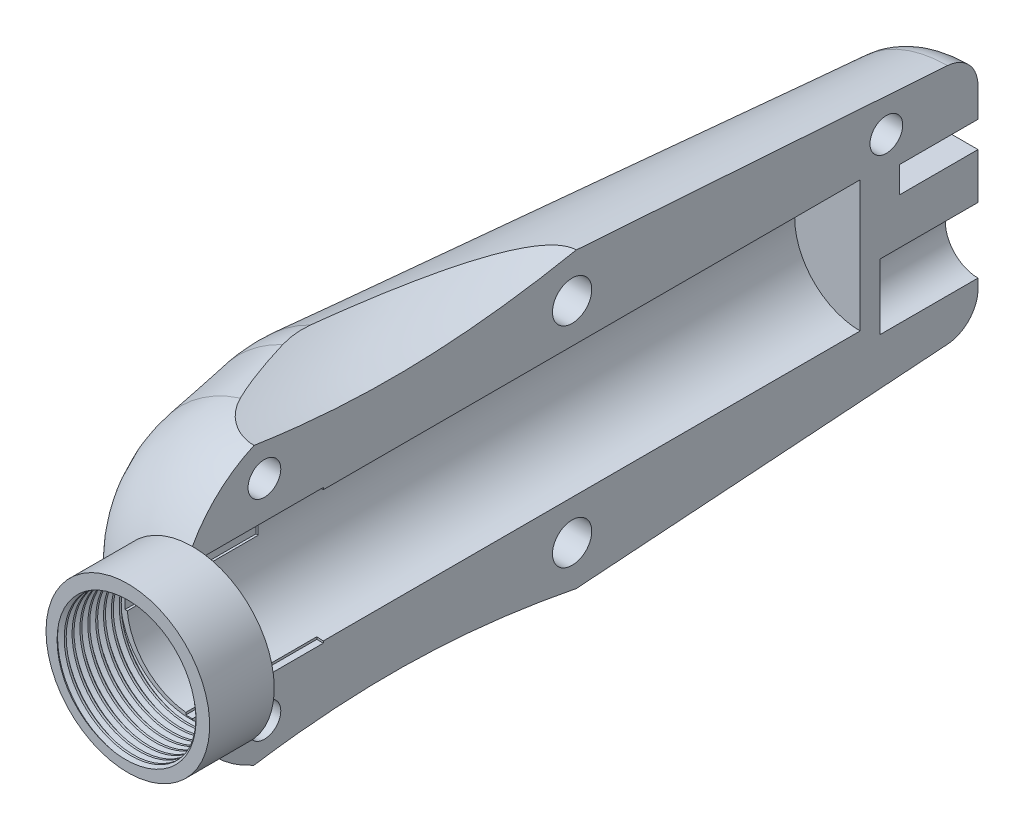
from build123d import *

# Parameters (mm, degrees)
SKETCH1_R           = 11.25
SKETCH1_R_2         = 5
BOSS_EXTRUDE1_DEPTH = 51
BOSS_EXTRUDE2_START = 9
SKETCH2_R           = 11.25
BOSS_EXTRUDE2_DEPTH = 9
CUT_EXTRUDE1_DEPTH  = 6
CUT_EXTRUDE2_START  = -2.5
SKETCH4_W           = 10
SKETCH4_H           = 2.5
CUT_EXTRUDE2_DEPTH  = 5
SKETCH5_R           = 2.5
CUT_EXTRUDE3_DEPTH  = 7.5
SKETCH6_W           = 1
SKETCH6_H           = 0.25
SKETCH6_W_2         = 0.25
SKETCH6_H_2         = 1
CUT_EXTRUDE4_DEPTH  = 10
SKETCH7_W           = 22.5
SKETCH7_H           = 22.5
SKETCH7_R           = 7.5
BOSS_EXTRUDE3_DEPTH = 55
SKETCH11_R          = 6.25
SKETCH11_R_2        = 5.5
BOSS_EXTRUDE4_DEPTH = 5
THREAD1_PITCH       = 0.6
SKETCH14_W          = 14.477531198
SKETCH14_H          = 32.54061919
CUT_EXTRUDE5_DEPTH  = 30
CIRPATTERN1_COUNT   = 4
FILLET1_R           = 10
FILLET2_R           = 10
FILLET5_R           = 2.5
SKETCH19_W          = 15.616957128
SKETCH19_H          = 30.431834888
CUT_EXTRUDE6_DEPTH  = 60
SKETCH20_R          = 1.25
SKETCH20_R_2        = 1.5
CUT_EXTRUDE7_DEPTH  = 3


with BuildPart() as part:
    # Sketch1 → Boss-Extrude1 (new body)
    with BuildSketch(Plane.XY):
        Circle(SKETCH1_R)
        Circle(SKETCH1_R_2, mode=Mode.SUBTRACT)
    extrude(amount=BOSS_EXTRUDE1_DEPTH)

    # Sketch2 → Boss-Extrude2 (add)
    with BuildSketch(Plane(origin=(0, 0, 0), x_dir=(-1, 0, 0), z_dir=(0, 0, -1)).offset(BOSS_EXTRUDE2_START)):
        Circle(SKETCH2_R)
    extrude(amount=-BOSS_EXTRUDE2_DEPTH)

    # Sketch3 → Cut-Extrude1 (cut)
    with BuildSketch(Plane(origin=(0, 0, -9), x_dir=(-1, 0, 0), z_dir=(0, 0, -1))):
        Polygon((-2, 4.5), (-3, 3.5), (-3, 2.5), (3, 2.5), (3, 3.5), (2, 4.5), align=None)
    extrude(amount=-CUT_EXTRUDE1_DEPTH, mode=Mode.SUBTRACT)

    # Sketch4 → Cut-Extrude2 (cut)
    with BuildSketch(Plane(origin=(0, 0, -9), x_dir=(-1, 0, 0), z_dir=(0, 0, -1)).offset(CUT_EXTRUDE2_START)):
        with Locations((0, -2.25)):
            Rectangle(SKETCH4_W, SKETCH4_H)
    extrude(amount=-CUT_EXTRUDE2_DEPTH, mode=Mode.SUBTRACT)

    # Sketch5 → Cut-Extrude3 (cut)
    with BuildSketch(Plane(origin=(0, 0, -9), x_dir=(-1, 0, 0), z_dir=(0, 0, -1))):
        with Locations((0, -3.5)):
            Circle(SKETCH5_R)
    extrude(amount=-CUT_EXTRUDE3_DEPTH, mode=Mode.SUBTRACT)

    # Sketch6 → Cut-Extrude4 (cut)
    with BuildSketch(Plane.XY.offset(51)):
        with Locations((0, 5.025)):
            Rectangle(SKETCH6_W, SKETCH6_H)
        with Locations((-5.025, 0)):
            Rectangle(SKETCH6_W_2, SKETCH6_H_2)
        with Locations((5.025, 0)):
            Rectangle(SKETCH6_W_2, SKETCH6_H_2)
        with Locations((0, -5.025)):
            Rectangle(SKETCH6_W, SKETCH6_H)
    extrude(amount=-CUT_EXTRUDE4_DEPTH, mode=Mode.SUBTRACT)

    # Sketch7 → Boss-Extrude3 (add)
    with BuildSketch(Plane.XY.offset(51)):
        Rectangle(SKETCH7_W, SKETCH7_H)
        Circle(SKETCH7_R, mode=Mode.SUBTRACT)
    extrude(amount=-BOSS_EXTRUDE3_DEPTH)

    # Sketch11 → Boss-Extrude4 (add)
    with BuildSketch(Plane.XY.offset(51)):
        Circle(SKETCH11_R)
        Circle(SKETCH11_R_2, mode=Mode.SUBTRACT)
    extrude(amount=BOSS_EXTRUDE4_DEPTH)

    # Thread1: the profile of Thread Profile1 profile screwed along a right-hand helix of 10 turns, 6 arcs to a turn; built about Z, then put on its axis
    thread1_z = Axis((0, 0, 0), (0, 0, 1))
    thread1_corners = [(5.5003, 0, -0.000173205), (5.5003, 0, 0.525173203), (5.175240475, 0, 0.337499999), (5.175240475, 0, 0.187499999)]
    with BuildLine(mode=Mode.PRIVATE) as thread1_profile:
        Line(thread1_corners[0], thread1_corners[1])
        Line(thread1_corners[1], thread1_corners[2])
        Line(thread1_corners[2], thread1_corners[3])
        Line(thread1_corners[3], thread1_corners[0])
    thread1_cap = Face(thread1_profile.wire())
    thread1_turn_angles = [0, 30, 60, 90, 120, 150, 180, 210, 240, 270, 300, 330, 360]
    thread1_turn_weights = [1, 0.8660254037844387, 1, 0.8660254037844387, 1, 0.8660254037844387, 1, 0.8660254037844387, 1, 0.8660254037844387, 1, 0.8660254037844387, 1]
    thread1_turn_rails = [Edge.make_bspline([Vector(p[0], p[1], 0).rotate(thread1_z, thread1_turn_angles[k]) / thread1_turn_weights[k] + Vector(0, 0, p[2] + THREAD1_PITCH * thread1_turn_angles[k] / 360) for k in range(13)], [0, 0, 0, 1, 1, 2, 2, 3, 3, 4, 4, 5, 5, 6, 6, 6], 2, thread1_turn_weights) for p in thread1_corners]
    thread1_turn_sides = [Face.make_surface_from_curves(thread1_turn_rails[p[0]], thread1_turn_rails[p[1]]) for p in [(0, 1), (1, 2), (2, 3), (3, 0)]]
    thread1 = Plane(origin=(0, 0, 57), x_dir=(-1, 0, 0), z_dir=(0, 0, -1)) * Solid(Shell([*[p.moved(Location((0, 0, THREAD1_PITCH * i))) for i in range(10) for p in thread1_turn_sides], thread1_cap, thread1_cap.rotate(thread1_z, 3600).moved(Location((0, 0, THREAD1_PITCH * 3600 / 360)))]))
    add(thread1)

    # Sketch14 → Cut-Extrude5 (cut)
    with BuildSketch(Plane(origin=(11.25, 0, 0), x_dir=(0, 0, -1), z_dir=(1, 0, 0))):
        with Locations((-63.170516655, 2.469298546)):
            Rectangle(SKETCH14_W, SKETCH14_H)
    extrude(amount=-CUT_EXTRUDE5_DEPTH, mode=Mode.SUBTRACT)

    # Sketch15 → Cut-Revolve2 (revolve, cut)
    with BuildSketch(Plane(origin=(0, 0, 0), x_dir=(1, 0, 0), z_dir=(0, 1, 0)), mode=Mode.PRIVATE) as cut_revolve2_sk:
        Polygon((-9, 9.75), (-12.321523567, -37.75), (-9, -57.75), (-13.720059806, -57.75), (-54, -633.779981552), (-54, 9.75), align=None)
    revolve(cut_revolve2_sk.sketch.rotate(Axis((0, 0, 0), (0, 0, -1)), 354.260829523), axis=Axis((0, 0, 0), (0, 0, -1)), mode=Mode.SUBTRACT)

    # Sketch17 → Cut-Revolve3 (revolve, cut)
    with BuildSketch(Plane(origin=(0, 22.25, 0), x_dir=(1, 0, 0), z_dir=(0, 1, 0))):
        with BuildLine():
            Line((0, 8.75), (0, -80.25))
            add(Edge.make_bspline(
                [(0, 8.75), (-6.837392998, -4.833326361), (-18.162607002, -35.75), (-6.837392998, -66.666673639), (0, -80.25)],
                knots=[0, 0, 0, 0, 0.5, 1, 1, 1, 1], degree=3))
        make_face()
    cut_revolve3 = revolve(axis=Axis((0, 22.25, -8.75), (0, 0, 1)), mode=Mode.SUBTRACT)

    # CirPattern1: Cut-Revolve3 ×4 about axis
    cirpattern1_axis = Axis((0, 0, 56), (0, 0, -1))
    for i in range(1, CIRPATTERN1_COUNT):
        add(cut_revolve3.rotate(cirpattern1_axis, i * 360 / CIRPATTERN1_COUNT), mode=Mode.SUBTRACT)

    # Fillet1
    # the kernel refuses this fillet: 10 mm, written as the material it takes off along each edge
    with BuildSketch(Plane(origin=(0, 0, 51), x_dir=(-0.9949874371070855, -0.0999999999953677, 0), z_dir=(-0.0999999999953677, 0.9949874371070855, 0))) as fillet1_piece_1:
        with BuildLine():
            CenterArc((1.440076791, -8.76724807), FILLET1_R, 9.429400963, 51.820366909)
            Line((11.304959012, -7.128926131), (11.502256656, -7.096159692))
            Line((11.502256656, -7.096159692), (10.318311848, 0.032766439))
            Line((10.318311848, 0.032766439), (10.121014204, 0.2))
            ThreePointArc((10.121014204, 0.2), (8.185507102, 0.2), (6.346198464, 0.175344961))
            Line((6.346198464, 0.175344961), (6.25, 0))
        make_face()
    revolve(axis=Axis((0, 0, 51), (0, 0, 1)), mode=Mode.SUBTRACT)

    # Fillet2
    # the kernel refuses this fillet: 10 mm, written as the material it takes off along each edge
    with BuildSketch(Plane(origin=(0, 0, 37.75), x_dir=(-0.9757453399449544, 0.21890872887051724, 0), z_dir=(-0.21890872887051724, -0.9757453399449544, 0))) as fillet2_piece_1:
        with BuildLine():
            CenterArc((12.321523567 - FILLET2_R * 1.00577669767, FILLET2_R * 0.0476898560037), FILLET2_R, 350.570599037, 13.429400963)
            Line((12.321523567 - FILLET2_R * 0.00821264741373, FILLET2_R * 0.117446329748), (12.321523567, 0))
            Line((12.321523567, 0), (12.321523567 - FILLET2_R * 0.0192884756277, -FILLET2_R * 0.116142337917))
        make_face()
    revolve(axis=Axis((0, 0, 37.75), (0, 0, -1)), revolution_arc=64.710109031, mode=Mode.SUBTRACT)
    with BuildSketch(Plane(origin=(0, 0, 37.75), x_dir=(-0.21890872887051768, -0.975745339944954, 0), z_dir=(0.975745339944954, -0.21890872887051768, 0))) as fillet2_piece_2:
        with BuildLine():
            CenterArc((12.321523567 - FILLET2_R * 1.00577669767, FILLET2_R * 0.0476898560037), FILLET2_R, 350.570599037, 13.429400963)
            Line((12.321523567 - FILLET2_R * 0.00821264741373, FILLET2_R * 0.117446329748), (12.321523567, 0))
            Line((12.321523567, 0), (12.321523567 - FILLET2_R * 0.0192884756277, -FILLET2_R * 0.116142337917))
        make_face()
    revolve(axis=Axis((0, 0, 37.75), (0, 0, -1)), revolution_arc=64.710109031, mode=Mode.SUBTRACT)
    with BuildSketch(Plane(origin=(0, 0, 37.75), x_dir=(0.9757453399449539, -0.21890872887051863, 0), z_dir=(0.21890872887051863, 0.9757453399449539, 0))) as fillet2_piece_3:
        with BuildLine():
            CenterArc((12.321523567 - FILLET2_R * 1.00577669767, FILLET2_R * 0.0476898560037), FILLET2_R, 350.570599037, 13.429400963)
            Line((12.321523567 - FILLET2_R * 0.00821264741373, FILLET2_R * 0.117446329748), (12.321523567, 0))
            Line((12.321523567, 0), (12.321523567 - FILLET2_R * 0.0192884756277, -FILLET2_R * 0.116142337917))
        make_face()
    revolve(axis=Axis((0, 0, 37.75), (0, 0, -1)), revolution_arc=64.710109031, mode=Mode.SUBTRACT)
    with BuildSketch(Plane(origin=(0, 0, 37.75), x_dir=(0.21890872887051785, 0.9757453399449543, 0), z_dir=(-0.9757453399449543, 0.21890872887051785, 0))) as fillet2_piece_4:
        with BuildLine():
            CenterArc((12.321523567 - FILLET2_R * 1.00577669767, FILLET2_R * 0.0476898560037), FILLET2_R, 350.570599037, 13.429400963)
            Line((12.321523567 - FILLET2_R * 0.00821264741373, FILLET2_R * 0.117446329748), (12.321523567, 0))
            Line((12.321523567, 0), (12.321523567 - FILLET2_R * 0.0192884756277, -FILLET2_R * 0.116142337917))
        make_face()
    revolve(axis=Axis((0, 0, 37.75), (0, 0, -1)), revolution_arc=64.710109031, mode=Mode.SUBTRACT)

    # Fillet5
    fillet5_edges = [part.edges().sort_by_distance(p)[0] for p in [
        (9.007069159, 0.905244511, -9),
    ]]
    fillet(fillet5_edges, radius=FILLET5_R)

    # Sketch19 → Cut-Extrude6 (cut)
    with BuildSketch(Plane(origin=(0, 0, -9), x_dir=(-1, 0, 0), z_dir=(0, 0, -1))):
        with Locations((-7.808478564, -0.684126521)):
            Rectangle(SKETCH19_W, SKETCH19_H)
    extrude(amount=-CUT_EXTRUDE6_DEPTH, mode=Mode.SUBTRACT)

    # Sketch20 → Cut-Extrude7 (cut)
    with BuildSketch(Plane(origin=(0, 0, 0), x_dir=(0, 0, -1), z_dir=(1, 0, 0))):
        with Locations(Location((-45.5, 8, 0), (0, 0, 90))):
            Circle(SKETCH20_R)
        with Locations(Location((-22, 8, 0), (0, 0, 90))):
            Circle(SKETCH20_R_2)
        with Locations(Location((2, 7, 0), (0, 0, 90))):
            Circle(SKETCH20_R)
        with Locations(Location((-22, -8, 0), (0, 0, 270))):
            Circle(SKETCH20_R_2)
        with Locations(Location((-45.5, -8, 0), (0, 0, 270))):
            Circle(SKETCH20_R)
    extrude(amount=-CUT_EXTRUDE7_DEPTH, mode=Mode.SUBTRACT)


solid = part.part
